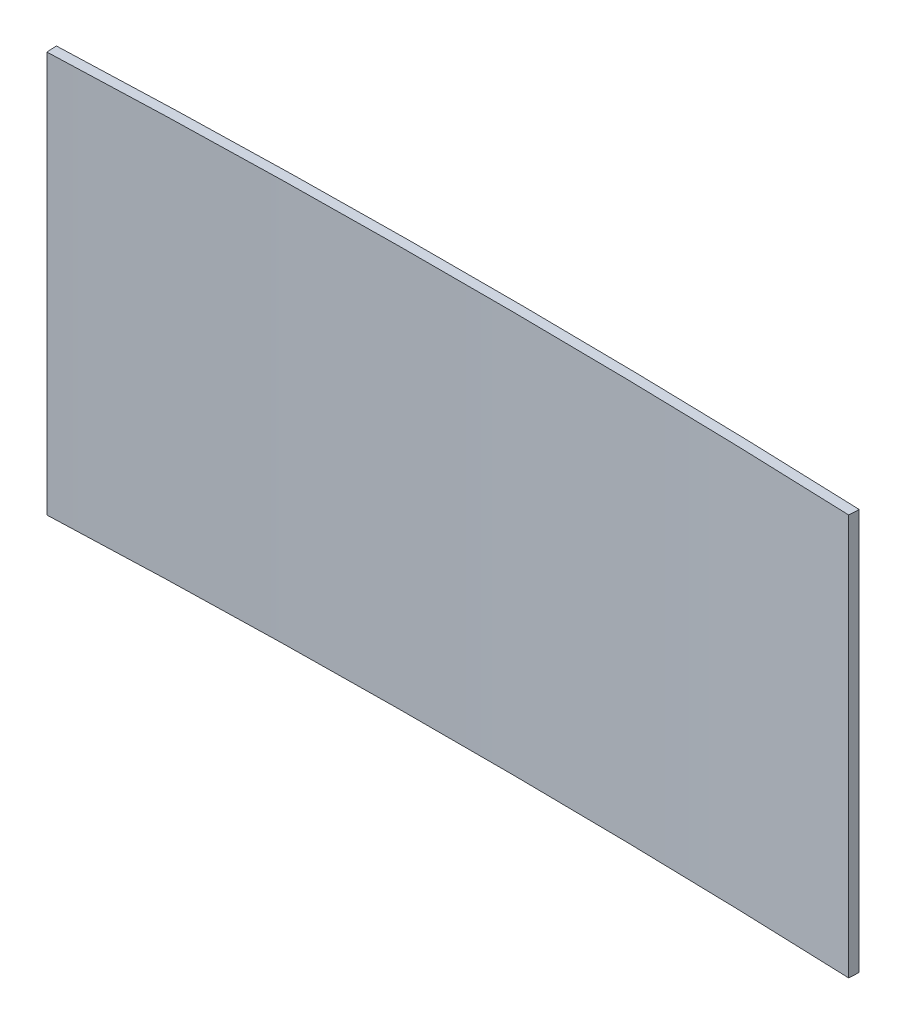
from build123d import *

# Parameters (mm, degrees)
SM_BASE_FLANGE_1_DEPTH = 20


# Sheet-metal steps are written as plain solids
with BuildPart() as part:
    # Sketch 1 → 基体-法兰1 (new, symmetric)
    with BuildSketch(Plane(origin=(0, 0, 0), x_dir=(1, 0, 0), z_dir=(0, 1, 0))):
        with BuildLine():
            ThreePointArc((40, 976.681242781), (0, 977.5), (-40, 976.681242781))
            Line((-40, 976.681242781), (-40.040920716, 977.680405178))
            ThreePointArc((-40.040920716, 977.680405178), (0, 978.5), (40.040920716, 977.680405178))
            Line((40.040920716, 977.680405178), (40, 976.681242781))
        make_face()
    extrude(amount=SM_BASE_FLANGE_1_DEPTH, both=True)


solid = part.part
